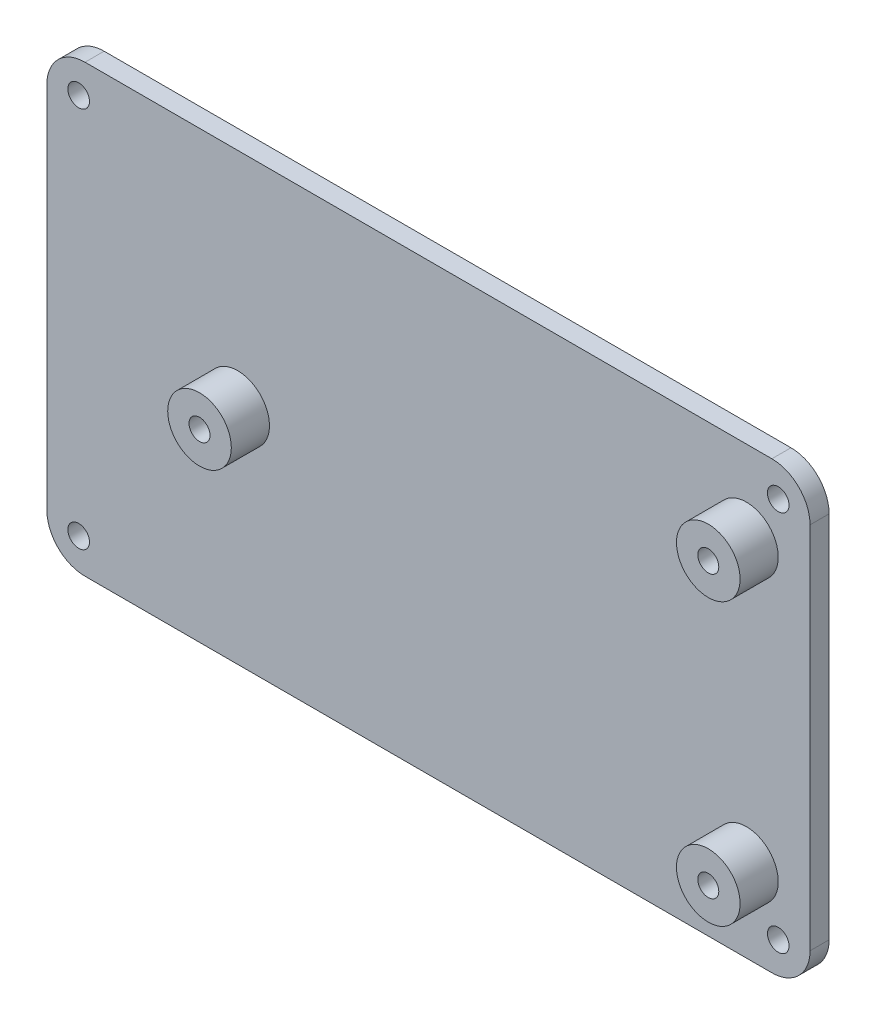
from build123d import *

# Parameters (mm, degrees)
SKETCH_1_W         = 120
SKETCH_1_H         = 70
EXTRUDE_1_DEPTH    = 3
SKETCH_2_R         = 5
EXTRUDE_2_DEPTH    = 6
M4X0_7_1_D         = 3.3
HOLE_WIZARD_M3_1_D = 3.4
FILLET_1_R         = 6


with BuildPart() as part:
    # 草圖1 → 填料-伸長1 (new body)
    with BuildSketch(Plane.XY):
        Rectangle(SKETCH_1_W, SKETCH_1_H)
    extrude(amount=EXTRUDE_1_DEPTH)

    # 草圖2 → 填料-伸長2 (add)
    with BuildSketch(Plane.XY.offset(3)):
        with Locations((50, 22.1)):
            Circle(SKETCH_2_R)
        with Locations((50, -22.1)):
            Circle(SKETCH_2_R)
        with Locations((-30, 0)):
            Circle(SKETCH_2_R)
    extrude(amount=EXTRUDE_2_DEPTH)

    # M4x0.7 螺紋孔1 (through all)
    with Locations(Plane.XY.offset(9)):
        with Locations((-30, 0), (50, 22.1), (50, -22.1)):
            Hole(M4X0_7_1_D / 2)

    # M3 餘隙孔1 (through all)
    with Locations(Plane.XY.offset(3)):
        with Locations((55, 30), (-55, -30), (-55, 30), (55, -30)):
            Hole(HOLE_WIZARD_M3_1_D / 2)

    # 圓角1
    fillet_1_edges = [part.edges().sort_by_distance(p)[0] for p in [
        (-60, -35, 1.5),
        (-60, 35, 1.5),
        (60, -35, 1.5),
        (60, 35, 1.5),
    ]]
    fillet(fillet_1_edges, radius=FILLET_1_R)


solid = part.part
